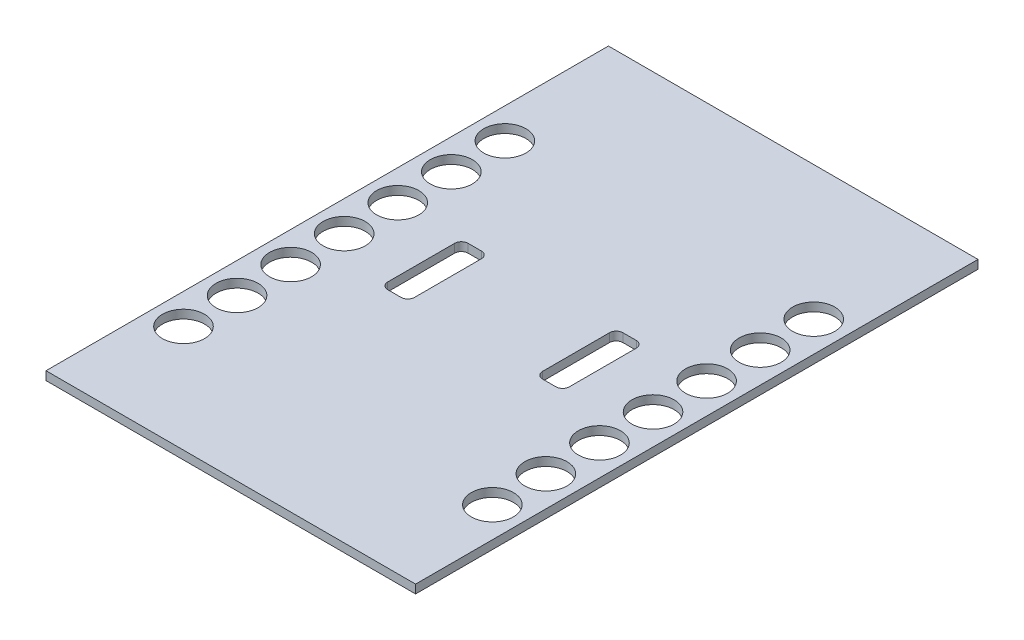
from build123d import *

# Parameters (mm, degrees)
SKETCH1_W           = 175.26
SKETCH1_H           = 266.7
BOSS_EXTRUDE1_DEPTH = 4.064
SKETCH2_W           = 12.7
SKETCH2_H           = 38.1
CUT_EXTRUDE1_DEPTH  = 160.617528787
FILLET1_R           = 3.175
SKETCH3_R           = 10
CUT_EXTRUDE2_DEPTH  = 160.617528787


with BuildPart() as part:
    # Sketch1 → Boss-Extrude1 (new body)
    with BuildSketch(Plane(origin=(0, 0, 0), x_dir=(1, 0, 0), z_dir=(0, 1, 0))):
        Rectangle(SKETCH1_W, SKETCH1_H)
    extrude(amount=BOSS_EXTRUDE1_DEPTH)

    # Sketch2 → Cut-Extrude1 (cut, through all)
    with BuildSketch(Plane(origin=(0, 4.064, 0), x_dir=(1, 0, 0), z_dir=(0, 1, 0))):
        with Locations((-36.7165001, 0)):
            Rectangle(SKETCH2_W, SKETCH2_H)
    cut_extrude1 = extrude(amount=-CUT_EXTRUDE1_DEPTH, mode=Mode.SUBTRACT)

    # Mirror1: Cut-Extrude1 across plane
    add(cut_extrude1.mirror(Plane(origin=(0, 0, 0), x_dir=(0, 0, 1), z_dir=(1, 0, 0))), mode=Mode.SUBTRACT)

    # Fillet1
    fillet1_edges = [part.edges().sort_by_distance(p)[0] for p in [
        (43.0665001, 2.032, 19.05),
        (30.3665001, 2.032, 19.05),
        (43.0665001, 2.032, -19.05),
        (30.3665001, 2.032, -19.05),
        (-30.3665001, 2.032, 19.05),
        (-43.0665001, 2.032, 19.05),
        (-30.3665001, 2.032, -19.05),
        (-43.0665001, 2.032, -19.05),
    ]]
    fillet(fillet1_edges, radius=FILLET1_R)

    # Sketch3 → Cut-Extrude2 (cut, through all)
    with BuildSketch(Plane(origin=(0, 4.064, 0), x_dir=(1, 0, 0), z_dir=(0, 1, 0))):
        with Locations((-73.23, 69.85)):
            Circle(SKETCH3_R)
        with Locations((-73.23, 44.45)):
            Circle(SKETCH3_R)
        with Locations((-73.23, 19.05)):
            Circle(SKETCH3_R)
        with Locations((-73.23, -6.35)):
            Circle(SKETCH3_R)
        with Locations((-73.23, -31.75)):
            Circle(SKETCH3_R)
        with Locations((-73.23, -57.15)):
            Circle(SKETCH3_R)
        with Locations((-73.23, -82.55)):
            Circle(SKETCH3_R)
    cut_extrude2 = extrude(amount=-CUT_EXTRUDE2_DEPTH, mode=Mode.SUBTRACT)

    # Mirror2: Cut-Extrude2 across plane
    add(cut_extrude2.mirror(Plane(origin=(0, 0, 0), x_dir=(0, 0, 1), z_dir=(1, 0, 0))), mode=Mode.SUBTRACT)


solid = part.part
